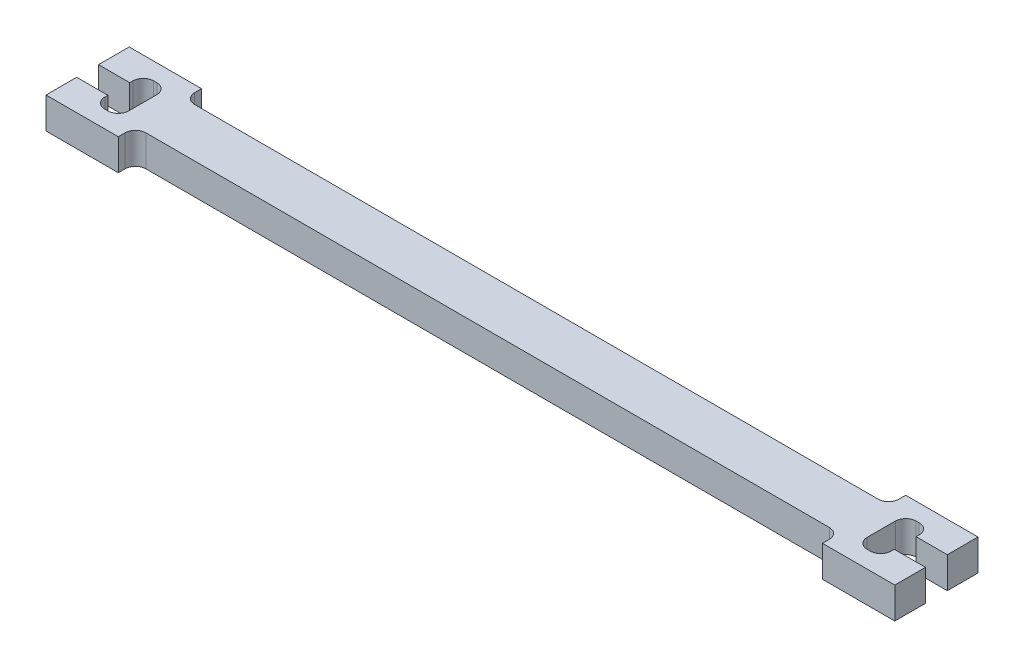
from build123d import *

# Parameters (mm, degrees)
BASE_SHAPE_DEPTH  = 3
MILLING_FILLETS_R = 1


with BuildPart() as part:
    # Sketch1 → Base shape (new body)
    with BuildSketch(Plane(origin=(0, 0, 0), x_dir=(1, 0, 0), z_dir=(0, 1, 0))):
        Polygon((-33.85, 4), (-40.8, 4), (-40.8, 1.05), (-37.8, 1.05), (-37.8, 2.35), (-35.5, 2.35), (-35.5, -2.35), (-37.8, -2.35), (-37.8, -1.05), (-40.8, -1.05), (-40.8, -4), (-33.85, -4), (-33.85, -2.35), (33.85, -2.35), (33.85, -4), (40.8, -4), (40.8, -1.05), (37.8, -1.05), (37.8, -2.35), (35.5, -2.35), (35.5, 2.35), (37.8, 2.35), (37.8, 1.05), (40.8, 1.05), (40.8, 4), (33.85, 4), (33.85, 2.35), (-33.85, 2.35), align=None)
    extrude(amount=BASE_SHAPE_DEPTH)

    # Milling fillets
    milling_fillets_edges = [part.edges().sort_by_distance(p)[0] for p in [
        (37.8, 1.5, 2.35),
        (-35.5, 1.5, 2.35),
        (-37.8, 1.5, 2.35),
        (35.5, 1.5, 2.35),
        (35.5, 1.5, -2.35),
        (-37.8, 1.5, -2.35),
        (-35.5, 1.5, -2.35),
        (37.8, 1.5, -2.35),
        (33.85, 1.5, 2.35),
        (33.85, 1.5, -2.35),
        (-33.85, 1.5, -2.35),
        (-33.85, 1.5, 2.35),
    ]]
    fillet(milling_fillets_edges, radius=MILLING_FILLETS_R)


solid = part.part
